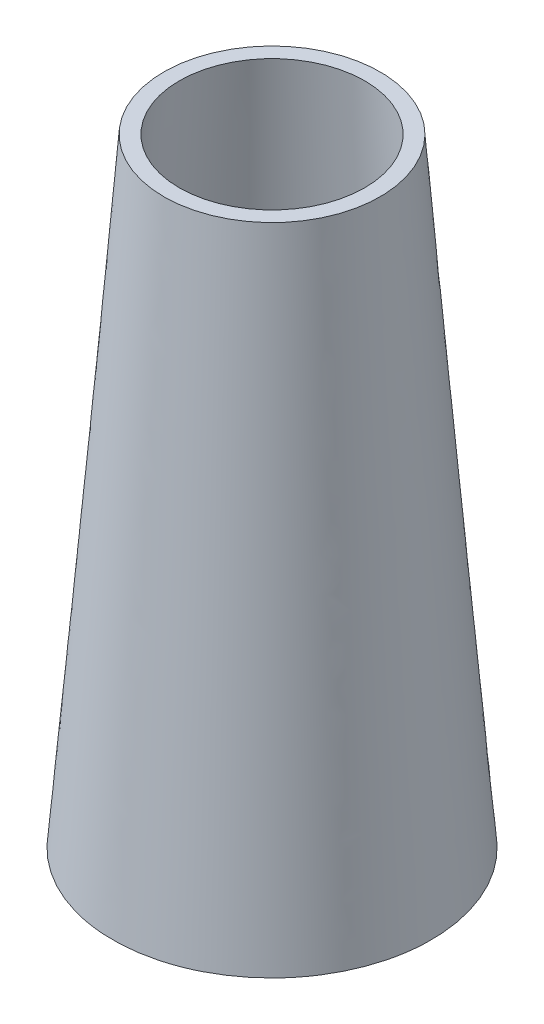
from build123d import *

# Parameters (mm, degrees)
SKETCH3_R = 3
SKETCH4_R = 4.65


with BuildPart() as part:
    # Loft1: read off the stored shape, not the designer's step
    # Loft1: loft between two sections, ruled curve by curve
    loft1_from = [
        Edge.make_bspline([(-1.49022752, 19.999999878, -3.166894684), (4.843561847, 19.999999878, -6.147349725), (7.824016888, 19.999999878, 0.186439643), (1.49022752, 19.999999878, 3.166894684), (-4.843561847, 19.999999878, 6.147349725), (-7.824016888, 19.999999878, -0.186439643), (-1.49022752, 19.999999878, -3.166894684)], [0, 0, 0, 0, 0.5, 0.5, 0.5, 1, 1, 1, 1], 3, [1, 0.333333333, 0.333333333, 1, 0.333333333, 0.333333333, 1]),
    ]
    loft1_to = [
        Edge.make_bspline([(-3.032327358, 0, -4.162630274), (5.29293319, 0, -10.227284989), (11.357587905, 0, -1.902024441), (3.032327358, 0, 4.162630274), (-5.29293319, 0, 10.227284989), (-11.357587905, 0, 1.902024441), (-3.032327358, 0, -4.162630274)], [0, 0, 0, 0, 0.5, 0.5, 0.5, 1, 1, 1, 1], 3, [1, 0.333333333, 0.333333333, 1, 0.333333333, 0.333333333, 1]),
    ]
    loft1 = Solid(Shell([*[Face.make_surface_from_curves(loft1_from[k], loft1_to[k]) for k in range(1)], Face(Wire(loft1_from)), Face(Wire(loft1_to))]))
    add(loft1)

    # Sketch3 → Cut-Loft1 section 0
    with BuildSketch(Plane(origin=(0, 19.999999878, 0), x_dir=(1, 0, 0), z_dir=(0, 1, 0))):
        Circle(SKETCH3_R)
    # Sketch4 → Cut-Loft1 section 1
    with BuildSketch(Plane.XZ):
        Circle(SKETCH4_R)
    loft(mode=Mode.SUBTRACT)


solid = part.part
